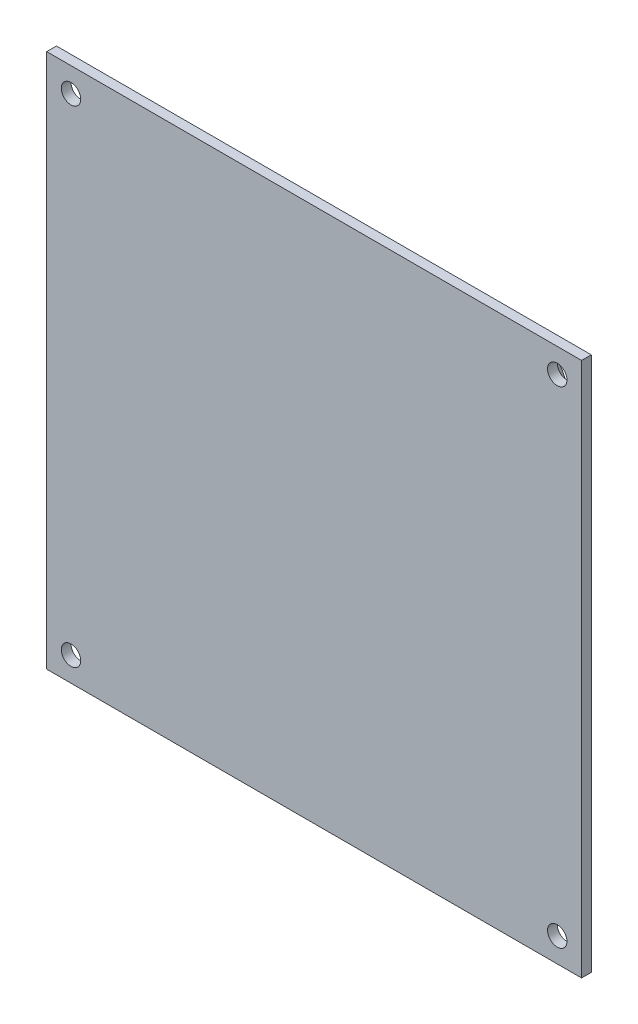
from build123d import *

# Parameters (mm, degrees)
SKETCH1_W           = 110
SKETCH1_H           = 110
SKETCH1_R           = 2
BOSS_EXTRUDE1_DEPTH = 2
SKETCH3_W           = 10
SKETCH3_H           = 30
BOSS_EXTRUDE2_DEPTH = 45
FILLET1_R           = 15


with BuildPart() as part:
    # Sketch1 → Boss-Extrude1 (new body)
    with BuildSketch(Plane.XY):
        Rectangle(SKETCH1_W, SKETCH1_H)
        with Locations((-50, 50)):
            Circle(SKETCH1_R, mode=Mode.SUBTRACT)
        with Locations((-50, -50)):
            Circle(SKETCH1_R, mode=Mode.SUBTRACT)
        with Locations((50, -50)):
            Circle(SKETCH1_R, mode=Mode.SUBTRACT)
        with Locations((50, 50)):
            Circle(SKETCH1_R, mode=Mode.SUBTRACT)
    extrude(amount=BOSS_EXTRUDE1_DEPTH)

    # Sketch3 → Boss-Extrude2 (add)
    with BuildSketch(Plane(origin=(0, 0, 0), x_dir=(-1, 0, 0), z_dir=(0, 0, -1))):
        Rectangle(SKETCH3_W, SKETCH3_H)
    extrude(amount=BOSS_EXTRUDE2_DEPTH)

    # Fillet1
    fillet1_edges = [part.edges().sort_by_distance(p)[0] for p in [
        (0, -15, -45),
        (0, 15, -45),
    ]]
    fillet(fillet1_edges, radius=FILLET1_R - 0.0001)  # a hair under: the kernel refuses the full size


solid = part.part
